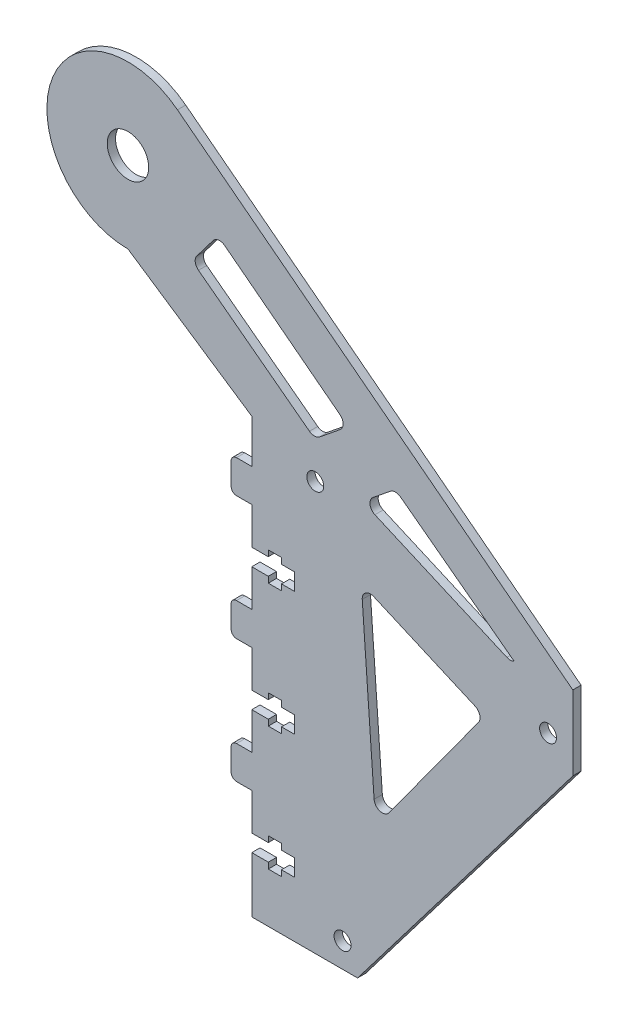
from build123d import *

# Parameters (mm, degrees)
SKETCH_1_R      = 5.0225
SKETCH_1_R_2    = 2.05
EXTRUDE_1_DEPTH = 2
FILLET_1_R      = 2
FILLET_2_R      = 1.3


with BuildPart() as part:
    # 草图1 → 凸台-拉伸1 (new body)
    with BuildSketch(Plane.XY):
        with BuildLine():
            Line((298.545628784, -83.894391363), (298.545628784, -92.841778663))
            Line((298.545628784, -92.841778663), (302.545628784, -92.841778663))
            Line((302.545628784, -92.841778663), (302.545628784, -91.391778663))
            Line((302.545628784, -91.391778663), (305.745628784, -91.391778663))
            Line((305.745628784, -91.391778663), (305.745628784, -92.841778663))
            Line((305.745628784, -92.841778663), (308.945628784, -92.841778663))
            Line((308.945628784, -92.841778663), (308.945628784, -96.941778663))
            Line((308.945628784, -96.941778663), (305.745628784, -96.941778663))
            Line((305.745628784, -96.941778663), (305.745628784, -98.391778663))
            Line((305.745628784, -98.391778663), (302.545628784, -98.391778663))
            Line((302.545628784, -98.391778663), (302.545628784, -96.941778663))
            Line((302.545628784, -96.941778663), (298.545628784, -96.941778663))
            Line((298.545628784, -96.941778663), (298.545628784, -105.894391358))
            Line((298.545628784, -105.894391358), (293.545628784, -105.894391358))
            Line((293.545628784, -105.894391358), (293.545628784, -113.894391358))
            Line((293.545628784, -113.894391358), (298.545628784, -113.894391358))
            Line((298.545628784, -113.894391358), (298.545628784, -122.847004054))
            Line((298.545628784, -122.847004054), (302.545628784, -122.847004054))
            Line((302.545628784, -122.847004054), (302.545628784, -121.397004054))
            Line((302.545628784, -121.397004054), (305.745628784, -121.397004054))
            Line((305.745628784, -121.397004054), (305.745628784, -122.847004054))
            Line((305.745628784, -122.847004054), (308.945628784, -122.847004054))
            Line((308.945628784, -122.847004054), (308.945628784, -126.947004054))
            Line((308.945628784, -126.947004054), (305.745628784, -126.947004054))
            Line((305.745628784, -126.947004054), (305.745628784, -128.397004054))
            Line((305.745628784, -128.397004054), (302.545628784, -128.397004054))
            Line((302.545628784, -128.397004054), (302.545628784, -126.947004054))
            Line((302.545628784, -126.947004054), (298.545628784, -126.947004054))
            Line((298.545628784, -126.947004054), (298.545628784, -140.447004054))
            Line((298.545628784, -140.447004054), (324.188862368, -140.447004054))
            Line((324.188862368, -140.447004054), (376.358604426, -71.946984141))
            Line((376.358604426, -71.946984141), (376.358604426, -53.889165972))
            Line((376.358604426, -53.889165972), (280.531751023, 19.960524179))
            ThreePointArc((280.531751023, 19.960524179), (249.936430553, 10.731954958), (268.536987634, -15.253798847))
            Line((268.536987634, -15.253798847), (298.545628784, -35.346984141))
            Line((298.545628784, -35.346984141), (298.545628784, -45.889165972))
            Line((298.545628784, -45.889165972), (293.545628784, -45.889165972))
            Line((293.545628784, -45.889165972), (293.545628784, -53.889165972))
            Line((293.545628784, -53.889165972), (298.545628784, -53.889165972))
            Line((298.545628784, -53.889165972), (298.545628784, -62.841778668))
            Line((298.545628784, -62.841778668), (302.545628784, -62.841778668))
            Line((302.545628784, -62.841778668), (302.545628784, -61.391778668))
            Line((302.545628784, -61.391778668), (305.745628784, -61.391778668))
            Line((305.745628784, -61.391778668), (305.745628784, -62.841778668))
            Line((305.745628784, -62.841778668), (308.945628784, -62.841778668))
            Line((308.945628784, -62.841778668), (308.945628784, -66.941778668))
            Line((308.945628784, -66.941778668), (305.745628784, -66.941778668))
            Line((305.745628784, -66.941778668), (305.745628784, -68.391778668))
            Line((305.745628784, -68.391778668), (302.545628784, -68.391778668))
            Line((302.545628784, -68.391778668), (302.545628784, -66.941778668))
            Line((302.545628784, -66.941778668), (298.545628784, -66.941778668))
            Line((298.545628784, -66.941778668), (298.545628784, -75.894391363))
            Line((298.545628784, -75.894391363), (293.545628784, -75.894391363))
            Line((293.545628784, -75.894391363), (293.545628784, -83.894391363))
            Line((293.545628784, -83.894391363), (298.545628784, -83.894391363))
        make_face()
        with Locations((268.536987634, 4.396201153)):
            Circle(SKETCH_1_R, mode=Mode.SUBTRACT)
        with Locations((320.545628784, -134.447004054)):
            Circle(SKETCH_1_R_2, mode=Mode.SUBTRACT)
        with Locations((370.358604426, -65.946984141)):
            Circle(SKETCH_1_R_2, mode=Mode.SUBTRACT)
        with Locations((313.936987634, -41.346984141)):
            Circle(SKETCH_1_R_2, mode=Mode.SUBTRACT)
        Polygon((354.947285032, -70.136765586), (328.579617375, -106.396108383), (325.08144343, -57.115165973), align=None, mode=Mode.SUBTRACT)
        Polygon((333.332304748, -33.322065963), (362.131919364, -54.975351392), (362.3086526, -55.891681452), (325.3728981, -39.787577877), align=None, mode=Mode.SUBTRACT)
        Polygon((290.367472723, -1.573041375), (321.906127186, -25.855107664), (313.781314718, -32.454980511), (284.02466426, -9.965407758), align=None, mode=Mode.SUBTRACT)
    extrude(amount=EXTRUDE_1_DEPTH)

    # 圆角1
    # the kernel refuses this fillet: 2 mm, written as the material it adds along each edge
    with BuildSketch(Plane(origin=(325.08144343, -57.115165973, 0), x_dir=(0.07080615119568372, -0.9974900946640293, 0), z_dir=(0, 0, 1))) as fillet_1_piece_1:
        with BuildLine():
            CenterArc((FILLET_1_R * 1.651770121, FILLET_1_R), FILLET_1_R, 152.382357743, 117.617642257)
            Line((FILLET_1_R * 0.765709239798, FILLET_1_R * 1.46356888895), (FILLET_1_R * 0.747988022174, FILLET_1_R * 1.47284026673))
            Line((FILLET_1_R * 0.747988022174, FILLET_1_R * 1.47284026673), (-FILLET_1_R * 0.03303540242, -FILLET_1_R * 0.02))
            Line((-FILLET_1_R * 0.03303540242, -FILLET_1_R * 0.02), (FILLET_1_R * 1.651770121, -FILLET_1_R * 0.02))
            Line((FILLET_1_R * 1.651770121, -FILLET_1_R * 0.02), (FILLET_1_R * 1.651770121, 0))
        make_face()
    extrude(amount=2)
    with BuildSketch(Plane(origin=(328.579617375, -106.396108383, 0), x_dir=(0.5881313815647177, 0.8087654035743471, 0), z_dir=(0, 0, 1))) as fillet_1_piece_2:
        with BuildLine():
            CenterArc((FILLET_1_R * 2.74116347671, FILLET_1_R), FILLET_1_R, 130.084808377, 139.915191623)
            Line((FILLET_1_R * 2.09724268379, FILLET_1_R * 1.76509215945), (FILLET_1_R * 2.08436426794, FILLET_1_R * 1.78039400264))
            Line((FILLET_1_R * 2.08436426794, FILLET_1_R * 1.78039400264), (-FILLET_1_R * 0.0128784158584, FILLET_1_R * 0.0153018431889))
            Line((-FILLET_1_R * 0.0128784158584, FILLET_1_R * 0.0153018431889), (0, -FILLET_1_R * 0.02))
            Line((0, -FILLET_1_R * 0.02), (FILLET_1_R * 2.74116347671, -FILLET_1_R * 0.02))
            Line((FILLET_1_R * 2.74116347671, -FILLET_1_R * 0.02), (FILLET_1_R * 2.74116347671, 0))
        make_face()
    extrude(amount=2)
    with BuildSketch(Plane(origin=(354.947285032, -70.136765586, 0), x_dir=(-0.588131381564712, -0.8087654035743512, 0), z_dir=(0, 0, 1))) as fillet_1_piece_3:
        with BuildLine():
            CenterArc((FILLET_1_R * 1.24524308483, -FILLET_1_R), FILLET_1_R, 90, 102.467166119)
            Line((FILLET_1_R * 0.268823205284, -FILLET_1_R * 1.2158801029), (FILLET_1_R * 0.249294807693, -FILLET_1_R * 1.22019770495))
            Line((FILLET_1_R * 0.249294807693, -FILLET_1_R * 1.22019770495), (-FILLET_1_R * 0.0249048616966, FILLET_1_R * 0.02))
            Line((-FILLET_1_R * 0.0249048616966, FILLET_1_R * 0.02), (FILLET_1_R * 1.24524308483, FILLET_1_R * 0.02))
            Line((FILLET_1_R * 1.24524308483, FILLET_1_R * 0.02), (FILLET_1_R * 1.24524308483, 0))
        make_face()
    extrude(amount=2)
    with BuildSketch(Plane(origin=(362.3086526, -55.891681452, 0), x_dir=(-0.18938048682828962, 0.9819037789970461, 0), z_dir=(0, 0, 1))) as fillet_1_piece_4:
        with BuildLine():
            CenterArc((2.840129073, 0.603066583), FILLET_1_R, 145.526016586, 52.023702881)
            Line((1.191362484, 1.73513051), (1.158387152, 1.757771789))
            Line((1.158387152, 1.757771789), (-0.032975332, 0.022641279))
            Line((-0.032975332, 0.022641279), (0, -0.04))
            ThreePointArc((0, -0.04), (0.466608888, -0.04), (0.895079549, -0.012061332))
            Line((0.895079549, -0.012061332), (0.933217775, 0))
        make_face()
    extrude(amount=2)
    with BuildSketch(Plane(origin=(333.332304748, -33.322065963, 0), x_dir=(0.7992857360296067, -0.60095117287481, 0), z_dir=(0, 0, 1))) as fillet_1_piece_5:
        with BuildLine():
            CenterArc((FILLET_1_R * 0.781642351799, -FILLET_1_R), FILLET_1_R, 90, 76.025379067)
            Line((-FILLET_1_R * 0.188760438175, -FILLET_1_R * 0.758507918948), (-FILLET_1_R * 0.208168493974, -FILLET_1_R * 0.753678077327))
            Line((-FILLET_1_R * 0.208168493974, -FILLET_1_R * 0.753678077327), (-FILLET_1_R * 0.015632847036, FILLET_1_R * 0.02))
            Line((-FILLET_1_R * 0.015632847036, FILLET_1_R * 0.02), (FILLET_1_R * 0.781642351799, FILLET_1_R * 0.02))
            Line((FILLET_1_R * 0.781642351799, FILLET_1_R * 0.02), (FILLET_1_R * 0.781642351799, 0))
        make_face()
    extrude(amount=2)
    with BuildSketch(Plane(origin=(325.3728981, -39.787577877, 0), x_dir=(0.9166604811079961, -0.3996668142026018, 0), z_dir=(0, 0, 1))) as fillet_1_piece_6:
        with BuildLine():
            CenterArc((FILLET_1_R * 1.64326737589, FILLET_1_R), FILLET_1_R, 152.644679345, 117.355320655)
            Line((FILLET_1_R * 0.755093396155, FILLET_1_R * 1.459507325), (FILLET_1_R * 0.737329916561, FILLET_1_R * 1.4686974715))
            Line((FILLET_1_R * 0.737329916561, FILLET_1_R * 1.4686974715), (-FILLET_1_R * 0.0328653475177, -FILLET_1_R * 0.02))
            Line((-FILLET_1_R * 0.0328653475177, -FILLET_1_R * 0.02), (FILLET_1_R * 1.64326737589, -FILLET_1_R * 0.02))
            Line((FILLET_1_R * 1.64326737589, -FILLET_1_R * 0.02), (FILLET_1_R * 1.64326737589, 0))
        make_face()
    extrude(amount=2)
    with BuildSketch(Plane(origin=(321.906127186, -25.855107664, 0), x_dir=(-0.7923621110530705, 0.6100510511158238, 0), z_dir=(0, 0, 1))) as fillet_1_piece_7:
        with BuildLine():
            CenterArc((FILLET_1_R * 1.2643919182, FILLET_1_R), FILLET_1_R, 166.68052265, 103.31947735)
            Line((FILLET_1_R * 0.291291305651, FILLET_1_R * 1.2303805501), (FILLET_1_R * 0.2718292934, FILLET_1_R * 1.2349881611))
            Line((FILLET_1_R * 0.2718292934, FILLET_1_R * 1.2349881611), (-FILLET_1_R * 0.0252878383639, -FILLET_1_R * 0.02))
            Line((-FILLET_1_R * 0.0252878383639, -FILLET_1_R * 0.02), (FILLET_1_R * 1.2643919182, -FILLET_1_R * 0.02))
            Line((FILLET_1_R * 1.2643919182, -FILLET_1_R * 0.02), (FILLET_1_R * 1.2643919182, 0))
        make_face()
    extrude(amount=2)
    with BuildSketch(Plane(origin=(313.781314718, -32.454980511, 0), x_dir=(0.7761858705448689, 0.6305041588812115, 0), z_dir=(0, 0, 1))) as fillet_1_piece_8:
        with BuildLine():
            CenterArc((FILLET_1_R * 0.7836591646, FILLET_1_R), FILLET_1_R, 193.831300809, 76.168699191)
            Line((-FILLET_1_R * 0.187344659052, FILLET_1_R * 0.760936045267), (-FILLET_1_R * 0.206764735525, FILLET_1_R * 0.756154766172))
            Line((-FILLET_1_R * 0.206764735525, FILLET_1_R * 0.756154766172), (-FILLET_1_R * 0.015673183292, -FILLET_1_R * 0.02))
            Line((-FILLET_1_R * 0.015673183292, -FILLET_1_R * 0.02), (FILLET_1_R * 0.7836591646, -FILLET_1_R * 0.02))
            Line((FILLET_1_R * 0.7836591646, -FILLET_1_R * 0.02), (FILLET_1_R * 0.7836591646, 0))
        make_face()
    extrude(amount=2)
    with BuildSketch(Plane(origin=(290.367472723, -1.573041375, 0), x_dir=(0.7923621110530753, -0.6100510511158177, 0), z_dir=(0, 0, 1))) as fillet_1_piece_9:
        with BuildLine():
            CenterArc((FILLET_1_R * 1.00897314279, -FILLET_1_R), FILLET_1_R, 90, 90.511823459)
            Line((FILLET_1_R * 0.00901304180913, -FILLET_1_R * 1.00893288575), (-FILLET_1_R * 0.0109861602105, -FILLET_1_R * 1.00911154346))
            Line((-FILLET_1_R * 0.0109861602105, -FILLET_1_R * 1.00911154346), (-FILLET_1_R * 0.0201794628558, FILLET_1_R * 0.02))
            Line((-FILLET_1_R * 0.0201794628558, FILLET_1_R * 0.02), (FILLET_1_R * 1.00897314279, FILLET_1_R * 0.02))
            Line((FILLET_1_R * 1.00897314279, FILLET_1_R * 0.02), (FILLET_1_R * 1.00897314279, 0))
        make_face()
    extrude(amount=2)
    with BuildSketch(Plane(origin=(284.02466426, -9.965407758, 0), x_dir=(0.7977800129226009, -0.6029486304663231, 0), z_dir=(0, 0, 1))) as fillet_1_piece_10:
        with BuildLine():
            CenterArc((FILLET_1_R, FILLET_1_R), FILLET_1_R, 180, 90)
            Line((0, FILLET_1_R), (-FILLET_1_R * 0.02, FILLET_1_R))
            Line((-FILLET_1_R * 0.02, FILLET_1_R), (-FILLET_1_R * 0.02, -FILLET_1_R * 0.02))
            Line((-FILLET_1_R * 0.02, -FILLET_1_R * 0.02), (FILLET_1_R, -FILLET_1_R * 0.02))
            Line((FILLET_1_R, -FILLET_1_R * 0.02), (FILLET_1_R, 0))
        make_face()
    extrude(amount=2)

    # 圆角2
    fillet_2_edges = [part.edges().sort_by_distance(p)[0] for p in [
        (293.545628784, -113.894391358, 1),
        (293.545628784, -105.894391358, 1),
        (293.545628784, -83.894391363, 1),
        (293.545628784, -75.894391363, 1),
        (293.545628784, -53.889165972, 1),
        (293.545628784, -45.889165972, 1),
    ]]
    fillet(fillet_2_edges, radius=FILLET_2_R)


solid = part.part
